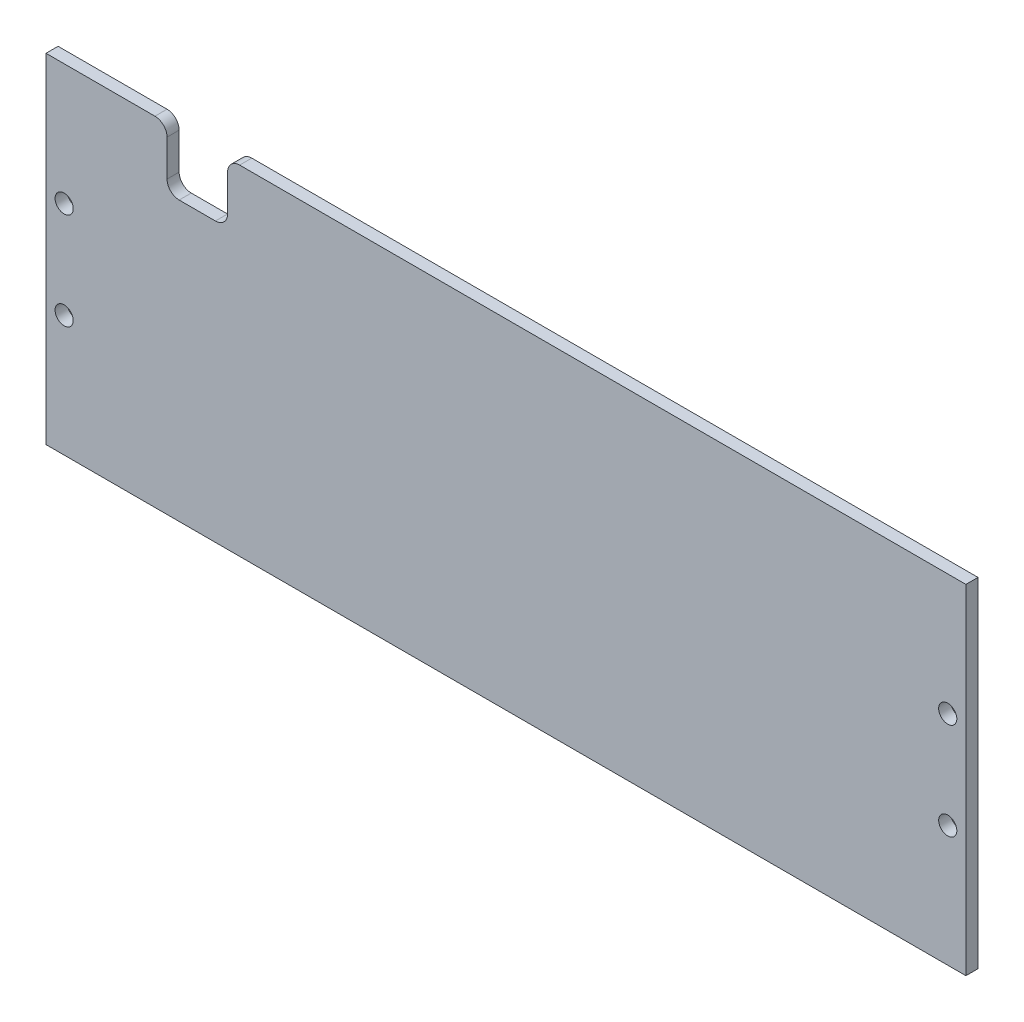
from build123d import *

# Parameters (mm, degrees)
ESQUISSE1_W             = 152
ESQUISSE1_H             = 56
ESQUISSE1_R             = 1.5
BOSS_EXTRU_1_DEPTH      = 2
ESQUISSE2_W             = 10
ESQUISSE2_H             = 10
ENL_V_MAT_EXTRU_1_DEPTH = 163
CONG_1_R                = 2


with BuildPart() as part:
    # Esquisse1 → Boss.-Extru.1 (new body)
    with BuildSketch(Plane.XY):
        with Locations((76, 28)):
            Rectangle(ESQUISSE1_W, ESQUISSE1_H)
        with Locations((3, 36)):
            Circle(ESQUISSE1_R, mode=Mode.SUBTRACT)
        with Locations((3, 20)):
            Circle(ESQUISSE1_R, mode=Mode.SUBTRACT)
        with Locations((149, 20)):
            Circle(ESQUISSE1_R, mode=Mode.SUBTRACT)
        with Locations((149, 36)):
            Circle(ESQUISSE1_R, mode=Mode.SUBTRACT)
    extrude(amount=BOSS_EXTRU_1_DEPTH)

    # Esquisse2 → Enlèv. mat.-Extru.1 (cut, through all)
    with BuildSketch(Plane.XY.offset(2)):
        with Locations((25, 51)):
            Rectangle(ESQUISSE2_W, ESQUISSE2_H)
    extrude(amount=-ENL_V_MAT_EXTRU_1_DEPTH, mode=Mode.SUBTRACT)

    # Congé1
    cong_1_edges = [part.edges().sort_by_distance(p)[0] for p in [
        (20, 56, 1),
        (30, 56, 1),
        (30, 46, 1),
        (20, 46, 1),
    ]]
    fillet(cong_1_edges, radius=CONG_1_R)


solid = part.part
